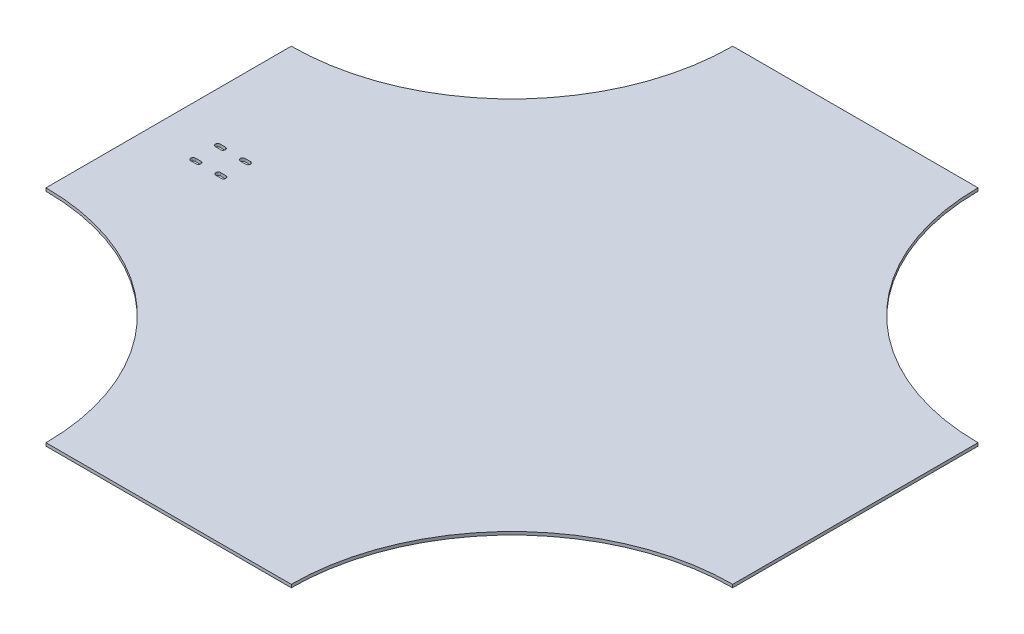
from build123d import *

# Parameters (mm, degrees)
BOSS_EXTRUDE1_DEPTH     = 3.175
CUT_EXTRUDE1_DEPTH      = 503.904365287
CUT_EXTRUDE1_DEPTH_BACK = 503.904365287


with BuildPart() as part:
    # Sketch1 → Boss-Extrude1 (new body)
    with BuildSketch(Plane(origin=(0, 0, 0), x_dir=(1, 0, 0), z_dir=(0, 1, 0))):
        with BuildLine():
            Line((-127, -355.6), (127, -355.6))
            ThreePointArc((127, -355.6), (193.955389821, -193.955389821), (355.6, -127))
            Line((355.6, -127), (355.6, 127))
            ThreePointArc((355.6, 127), (193.955389821, 193.955389821), (127, 355.6))
            Line((127, 355.6), (-127, 355.6))
            ThreePointArc((-127, 355.6), (-193.955389821, 193.955389821), (-355.6, 127))
            Line((-355.6, 127), (-355.6, -127))
            ThreePointArc((-355.6, -127), (-193.955389821, -193.955389821), (-127, -355.6))
        make_face()
    extrude(amount=BOSS_EXTRUDE1_DEPTH)

    # Sketch2 → Cut-Extrude1 (cut, two sides: drawn at the far end of the back side and taken through both)
    with BuildSketch(Plane(origin=(0, 3.175, 0), x_dir=(1, 0, 0), z_dir=(0, 1, 0)).offset(-CUT_EXTRUDE1_DEPTH_BACK)):
        with BuildLine():
            Line((-304.8, 2.413), (-299.212, 2.413))
            ThreePointArc((-299.212, 2.413), (-296.799, 0), (-299.212, -2.413))
            Line((-299.212, -2.413), (-304.8, -2.413))
            ThreePointArc((-304.8, -2.413), (-307.213, 0), (-304.8, 2.413))
        make_face()
        with BuildLine():
            Line((-304.8, -22.987), (-299.212, -22.987))
            ThreePointArc((-299.212, -22.987), (-296.799, -25.4), (-299.212, -27.813))
            Line((-299.212, -27.813), (-304.8, -27.813))
            ThreePointArc((-304.8, -27.813), (-307.213, -25.4), (-304.8, -22.987))
        make_face()
        with BuildLine():
            Line((-278.892, -2.413), (-273.304, -2.413))
            ThreePointArc((-273.304, -2.413), (-270.891, 0), (-273.304, 2.413))
            Line((-273.304, 2.413), (-278.892, 2.413))
            ThreePointArc((-278.892, 2.413), (-281.305, 0), (-278.892, -2.413))
        make_face()
        with BuildLine():
            Line((-278.892, -22.987), (-273.304, -22.987))
            ThreePointArc((-273.304, -22.987), (-270.891, -25.4), (-273.304, -27.813))
            Line((-273.304, -27.813), (-278.892, -27.813))
            ThreePointArc((-278.892, -27.813), (-281.305, -25.4), (-278.892, -22.987))
        make_face()
    extrude(amount=CUT_EXTRUDE1_DEPTH + CUT_EXTRUDE1_DEPTH_BACK, mode=Mode.SUBTRACT)


solid = part.part
